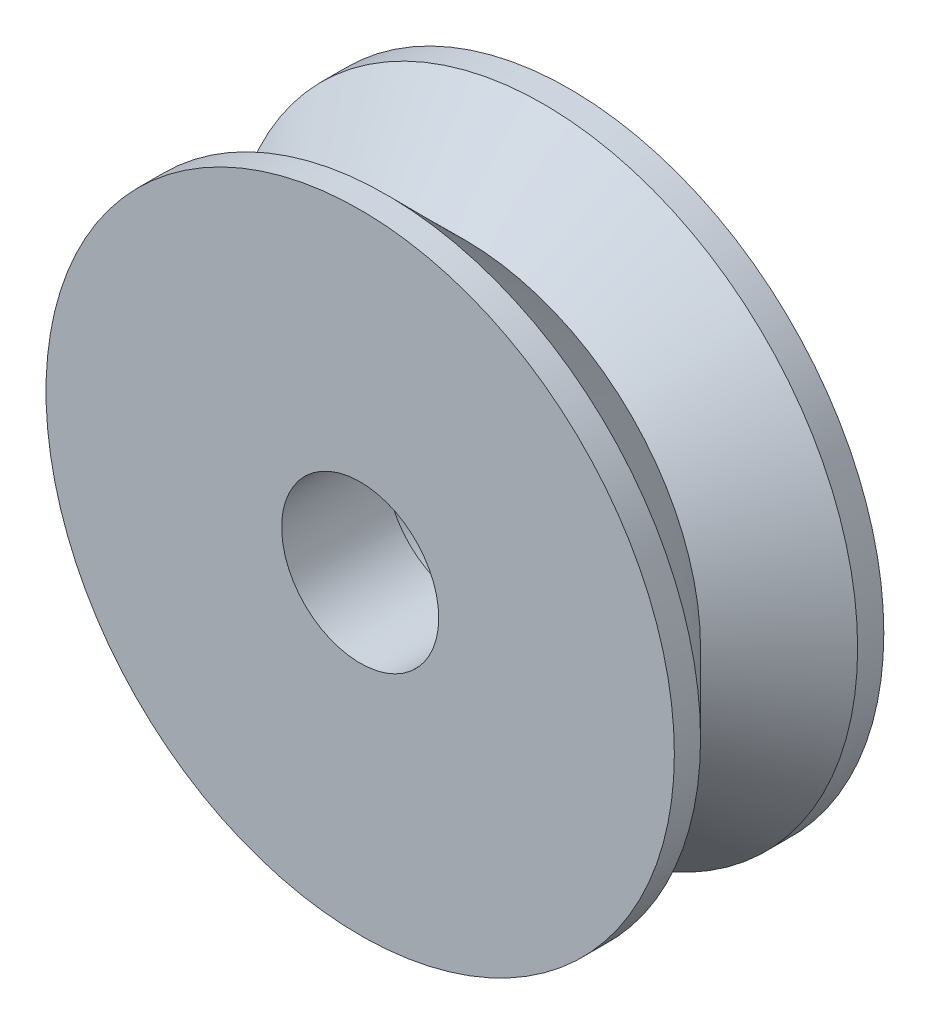
from build123d import *

# Parameters (mm, degrees)
SKETCH1_R           = 6
SKETCH1_R_2         = 1.9
BOSS_EXTRUDE1_DEPTH = 2
CHAMFER1_SIZE       = 1.5
SKETCH2_R           = 6
SKETCH2_R_2         = 1.5
BOSS_EXTRUDE2_DEPTH = 2
CHAMFER2_SIZE       = 1.5


with BuildPart() as part:
    # Sketch1 → Boss-Extrude1 (new body)
    with BuildSketch(Plane.XY):
        Circle(SKETCH1_R)
        Circle(SKETCH1_R_2, mode=Mode.SUBTRACT)
    extrude(amount=BOSS_EXTRUDE1_DEPTH)

    # Chamfer1
    chamfer1_edges = [part.edges().sort_by_distance(p)[0] for p in [
        (-6, 0, 2),
    ]]
    chamfer(chamfer1_edges, length=CHAMFER1_SIZE)

    # Sketch2 → Boss-Extrude2 (add)
    with BuildSketch(Plane.XY.offset(2)):
        Circle(SKETCH2_R)
        Circle(SKETCH2_R_2, mode=Mode.SUBTRACT)
    extrude(amount=BOSS_EXTRUDE2_DEPTH)

    # Chamfer2
    chamfer2_edges = [part.edges().sort_by_distance(p)[0] for p in [
        (-6, 0, 2),
    ]]
    chamfer(chamfer2_edges, length=CHAMFER2_SIZE - 0.0001)  # a hair under: the kernel refuses the full size


solid = part.part
